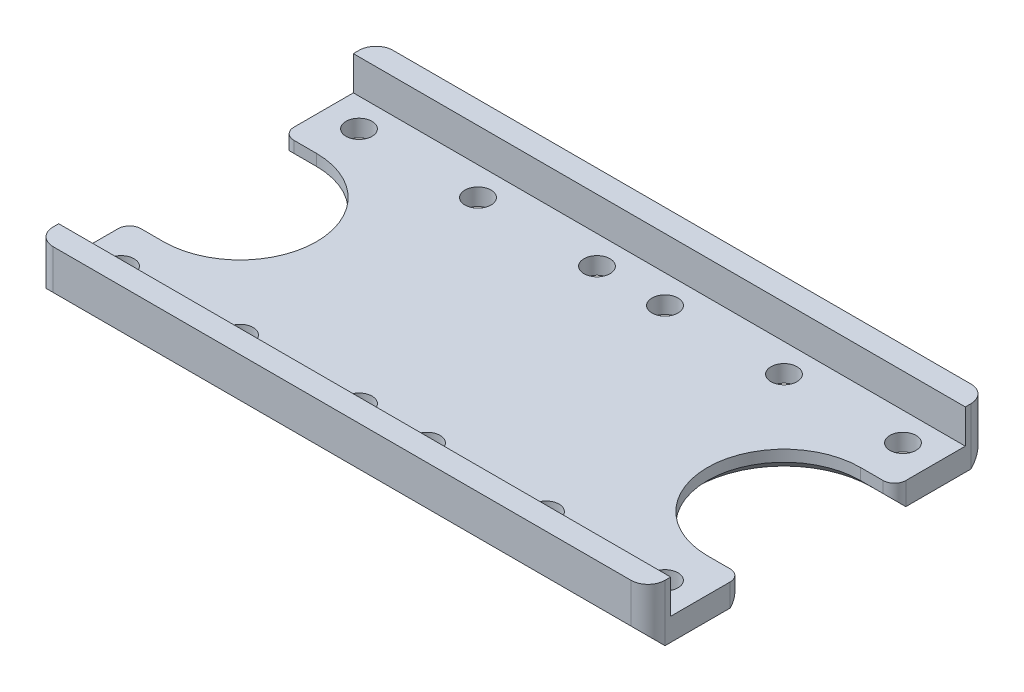
from build123d import *

# Parameters (mm, degrees)
EXTRUDE_1_DEPTH              = 27
CUT_EXTRUDE_1_REACH          = 33.032
HOLE_WIZARD_M2_1_D           = 2.3
HOLE_WIZARD_M2_1_CBORE_D     = 3.8
HOLE_WIZARD_M2_1_CBORE_DEPTH = 0.5
PATTERN_LINEAR_1_COUNT       = 3
PATTERN_LINEAR_1_PITCH       = 10.5
MIRROR_1_COPY_1_D            = 2.3
MIRROR_1_COPY_1_CBORE_D      = 3.8
MIRROR_1_COPY_1_CBORE_DEPTH  = 0.5
MIRROR_1_COPY_2_D            = 2.3
MIRROR_1_COPY_2_CBORE_D      = 3.8
MIRROR_1_COPY_2_CBORE_DEPTH  = 0.5
CHAMFER_1_SIZE               = 1
MIRROR_3_COPY_1_D            = 2.3
MIRROR_3_COPY_1_CBORE_D      = 3.8
MIRROR_3_COPY_1_CBORE_DEPTH  = 0.5
MIRROR_3_COPY_2_D            = 2.3
MIRROR_3_COPY_2_CBORE_D      = 3.8
MIRROR_3_COPY_2_CBORE_DEPTH  = 0.5
MIRROR_3_COPY_3_D            = 2.3
MIRROR_3_COPY_3_CBORE_D      = 3.8
MIRROR_3_COPY_3_CBORE_DEPTH  = 0.5
MIRROR_3_COPY_4_D            = 2.3
MIRROR_3_COPY_4_CBORE_D      = 3.8
MIRROR_3_COPY_4_CBORE_DEPTH  = 0.5
MIRROR_3_COPY_5_D            = 2.3
MIRROR_3_COPY_5_CBORE_D      = 3.8
MIRROR_3_COPY_5_CBORE_DEPTH  = 0.5
CHAMFER_1_OF_MIRROR_3_SIZE   = 1
FILLET_1_R                   = 1.5
FILLET_2_R                   = 1
CHAMFER_2_SIZE               = 1.5


with BuildPart() as part:
    # ｽｹｯﾁ1 → ﾎﾞｽ - 押し出し1 (new, symmetric)
    with BuildSketch(Plane(origin=(0, 0, 0), x_dir=(0, 0, -1), z_dir=(1, 0, 0))):
        Polygon((-15, 0), (15, 0), (15, 5), (13, 5), (13, 2), (-13, 2), (-13, 5), (-15, 5), align=None)
    extrude(amount=EXTRUDE_1_DEPTH, both=True)

    # ｽｹｯﾁ2 → ｶｯﾄ - 押し出し1 (cut, up to next)
    with BuildSketch(Plane(origin=(0, 2, 0), x_dir=(1, 0, 0), z_dir=(0, 1, 0)), mode=Mode.PRIVATE) as cut_extrude_1_sk1:
        with BuildLine():
            Line((24, 6.75), (28, 6.75))
            Line((28, 6.75), (28, -6.75))
            Line((28, -6.75), (24, -6.75))
            ThreePointArc((24, -6.75), (17.25, 0), (24, 6.75))
        make_face()
    cut_extrude_1_tool1 = extrude(cut_extrude_1_sk1.sketch, amount=-CUT_EXTRUDE_1_REACH, mode=Mode.PRIVATE) & part.part
    cut_extrude_1 = cut_extrude_1_tool1.solids().sort_by_distance((23.22727, 2, 0))[0]
    add(cut_extrude_1, mode=Mode.SUBTRACT)

    # M2 丸平ねじ用座ぐり穴1 (through all)
    with Locations(Plane(origin=(0, 0, 0), x_dir=(-1, 0, 0), z_dir=(0, -1, 0))):
        with Locations((-24, -10.5)):
            hole_wizard_m2_1 = CounterBoreHole(HOLE_WIZARD_M2_1_D / 2, HOLE_WIZARD_M2_1_CBORE_D / 2, HOLE_WIZARD_M2_1_CBORE_DEPTH)

    # 直線ﾊﾟﾀｰﾝ1: M2 丸平ねじ用座ぐり穴1 ×3
    with Locations(*[(-i * PATTERN_LINEAR_1_PITCH, 0, 0) for i in range(1, PATTERN_LINEAR_1_COUNT)]):
        add(hole_wizard_m2_1, mode=Mode.SUBTRACT)

    # ﾐﾗｰ1: M2 丸平ねじ用座ぐり穴1 across plane
    add(hole_wizard_m2_1.mirror(Plane.XY), mode=Mode.SUBTRACT)

    # ﾐﾗｰ1 copy 1 (through all)
    with Locations(Plane(origin=(-10.5, 0, 0), x_dir=(-1, 0, 0), z_dir=(0, -1, 0))):
        with Locations((-24, 10.5)):
            CounterBoreHole(MIRROR_1_COPY_1_D / 2, MIRROR_1_COPY_1_CBORE_D / 2, MIRROR_1_COPY_1_CBORE_DEPTH)

    # ﾐﾗｰ1 copy 2 (through all)
    with Locations(Plane(origin=(-21, 0, 0), x_dir=(-1, 0, 0), z_dir=(0, -1, 0))):
        with Locations((-24, 10.5)):
            CounterBoreHole(MIRROR_1_COPY_2_D / 2, MIRROR_1_COPY_2_CBORE_D / 2, MIRROR_1_COPY_2_CBORE_DEPTH)

    # 面取り1
    chamfer_1_edges = [part.edges().sort_by_distance(p)[0] for p in [
        (25.5, 0, 6.75),
        (17.25, 0, 0),
        (25.5, 0, -6.75),
    ]]
    chamfer(chamfer_1_edges, length=CHAMFER_1_SIZE)

    # ﾐﾗｰ3: ｶｯﾄ - 押し出し1, M2 丸平ねじ用座ぐり穴1 across plane
    add(cut_extrude_1.mirror(Plane(origin=(0, 0, 0), x_dir=(0, 0, 1), z_dir=(1, 0, 0))), mode=Mode.SUBTRACT)
    add(hole_wizard_m2_1.mirror(Plane(origin=(0, 0, 0), x_dir=(0, 0, 1), z_dir=(1, 0, 0))), mode=Mode.SUBTRACT)

    # ﾐﾗｰ3 copy 1 (through all)
    with Locations(Plane(origin=(10.5, 0, 0), x_dir=(1, 0, 0), z_dir=(0, -1, 0))):
        with Locations((-24, 10.5)):
            CounterBoreHole(MIRROR_3_COPY_1_D / 2, MIRROR_3_COPY_1_CBORE_D / 2, MIRROR_3_COPY_1_CBORE_DEPTH)

    # ﾐﾗｰ3 copy 2 (through all)
    with Locations(Plane(origin=(21, 0, 0), x_dir=(1, 0, 0), z_dir=(0, -1, 0))):
        with Locations((-24, 10.5)):
            CounterBoreHole(MIRROR_3_COPY_2_D / 2, MIRROR_3_COPY_2_CBORE_D / 2, MIRROR_3_COPY_2_CBORE_DEPTH)

    # ﾐﾗｰ3 copy 3 (through all)
    with Locations(Plane.XZ):
        with Locations((-24, -10.5)):
            CounterBoreHole(MIRROR_3_COPY_3_D / 2, MIRROR_3_COPY_3_CBORE_D / 2, MIRROR_3_COPY_3_CBORE_DEPTH)

    # ﾐﾗｰ3 copy 4 (through all)
    with Locations(Plane(origin=(10.5, 0, 0), x_dir=(1, 0, 0), z_dir=(0, -1, 0))):
        with Locations((-24, -10.5)):
            CounterBoreHole(MIRROR_3_COPY_4_D / 2, MIRROR_3_COPY_4_CBORE_D / 2, MIRROR_3_COPY_4_CBORE_DEPTH)

    # ﾐﾗｰ3 copy 5 (through all)
    with Locations(Plane(origin=(21, 0, 0), x_dir=(1, 0, 0), z_dir=(0, -1, 0))):
        with Locations((-24, -10.5)):
            CounterBoreHole(MIRROR_3_COPY_5_D / 2, MIRROR_3_COPY_5_CBORE_D / 2, MIRROR_3_COPY_5_CBORE_DEPTH)

    # 面取り1 of ﾐﾗｰ3
    chamfer_1_of_mirror_3_edges = [part.edges().sort_by_distance(p)[0] for p in [
        (-25.5, 0, 6.75),
        (-17.25, 0, 0),
        (-25.5, 0, -6.75),
    ]]
    chamfer(chamfer_1_of_mirror_3_edges, length=CHAMFER_1_OF_MIRROR_3_SIZE)

    # ﾌｨﾚｯﾄ1
    fillet_1_edges = [part.edges().sort_by_distance(p)[0] for p in [
        (27, 2.5, -15),
        (-27, 2.5, 15),
        (27, 2.5, 15),
        (-27, 2.5, -15),
    ]]
    fillet(fillet_1_edges, radius=FILLET_1_R)

    # ﾌｨﾚｯﾄ2
    fillet_2_edges = [part.edges().sort_by_distance(p)[0] for p in [
        (27, 1.5, -6.75),
        (27, 1.5, 6.75),
        (-27, 1.5, -6.75),
        (-27, 1.5, 6.75),
    ]]
    fillet(fillet_2_edges, radius=FILLET_2_R)

    # 面取り2
    # the kernel refuses this chamfer: 1.5 mm, written as the material it takes off along each edge
    with BuildSketch(Plane(origin=(-29.357524482, 0, -15), x_dir=(0, -0.027495876610586542, 0.9996219169112968), z_dir=(1, 0, 0)), Plane(origin=(29.357524482, 0, 15), x_dir=(0, -0.027495876610586178, -0.9996219169112968), z_dir=(-1, 0, 0))) as chamfer_2_piece_1:
        Polygon((CHAMFER_2_SIZE * 0.999621916911, -CHAMFER_2_SIZE * 0.0274958766106), (-CHAMFER_2_SIZE * 0.0274958766106, -CHAMFER_2_SIZE * 0.999621916911), (0, 0), align=None)
    extrude(amount=58.715048964, mode=Mode.SUBTRACT)


solid = part.part
